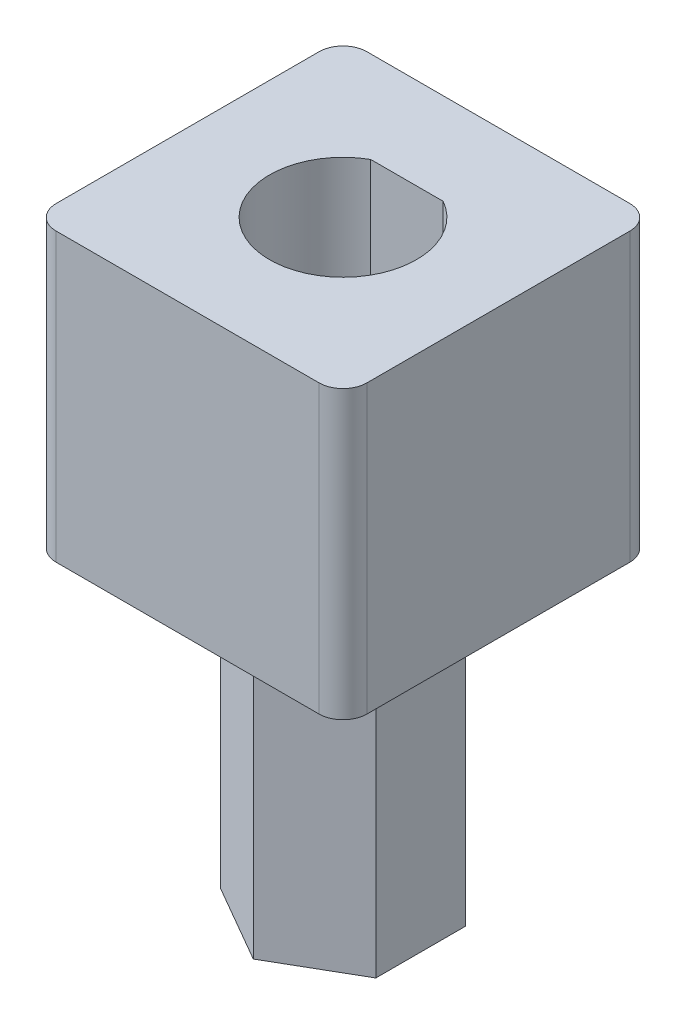
from build123d import *

# Parameters (mm, degrees)
SKETCH1_R           = 1.425
BOSS_EXTRUDE1_DEPTH = 13
SKETCH2_W           = 13
SKETCH2_H           = 13
SKETCH2_R           = 3.075
BOSS_EXTRUDE2_DEPTH = 12
BOSS_EXTRUDE3_REACH = 28.636
SKETCH5_R           = 1.425
CUT_EXTRUDE1_DEPTH  = 12
FILLET2_R           = 1


with BuildPart() as part:
    # Sketch1 → Boss-Extrude1 (new body)
    with BuildSketch(Plane(origin=(0, 0, 0), x_dir=(1, 0, 0), z_dir=(0, 1, 0))):
        Polygon((0, -3.75277675), (3.25, -1.876388375), (3.25, 1.876388375), (0, 3.75277675), (-3.25, 1.876388375), (-3.25, -1.876388375), align=None)
        Circle(SKETCH1_R, mode=Mode.SUBTRACT)
    extrude(amount=BOSS_EXTRUDE1_DEPTH)

    # Sketch2 → Boss-Extrude2 (add)
    with BuildSketch(Plane(origin=(0, 13, 0), x_dir=(1, 0, 0), z_dir=(0, 1, 0))):
        Rectangle(SKETCH2_W, SKETCH2_H)
        Circle(SKETCH2_R, mode=Mode.SUBTRACT)
    extrude(amount=BOSS_EXTRUDE2_DEPTH)

    # Sketch3 → Boss-Extrude3 (add, up to next)
    with BuildSketch(Plane(origin=(0, 25, 0), x_dir=(1, 0, 0), z_dir=(0, 1, 0)), mode=Mode.PRIVATE) as boss_extrude3_sk1:
        with BuildLine():
            Line((-1.516575089, 2.675), (1.516575089, 2.675))
            ThreePointArc((1.516575089, 2.675), (0, 3.075), (-1.516575089, 2.675))
        make_face()
    boss_extrude3_tool1 = extrude(boss_extrude3_sk1.sketch, amount=-BOSS_EXTRUDE3_REACH, mode=Mode.PRIVATE) - part.part
    add(boss_extrude3_tool1.solids().sort_by_distance((0, 25, -2.835927))[0])

    # Sketch5 → Cut-Extrude1 (cut)
    with BuildSketch(Plane.XY.offset(-2.675)):
        with Locations((0, 20)):
            Circle(SKETCH5_R)
    extrude(amount=-CUT_EXTRUDE1_DEPTH, mode=Mode.SUBTRACT)

    # Fillet2
    fillet2_edges = [part.edges().sort_by_distance(p)[0] for p in [
        (6.5, 19, 6.5),
        (-6.5, 19, 6.5),
        (6.5, 19, -6.5),
        (-6.5, 19, -6.5),
    ]]
    fillet(fillet2_edges, radius=FILLET2_R)

    # Sketch8 → Revolve1 (revolve)
    with BuildSketch(Plane(origin=(0, 0, 0), x_dir=(0, 0, -1), z_dir=(1, 0, 0))):
        Polygon((0, 13), (-3.75277675, 13), (-6.25277675, 13), (-3.75277675, 11), (0, 11), align=None)
    revolve(axis=Axis((0, -1000, 0), (0, 1, 0)))


solid = part.part
